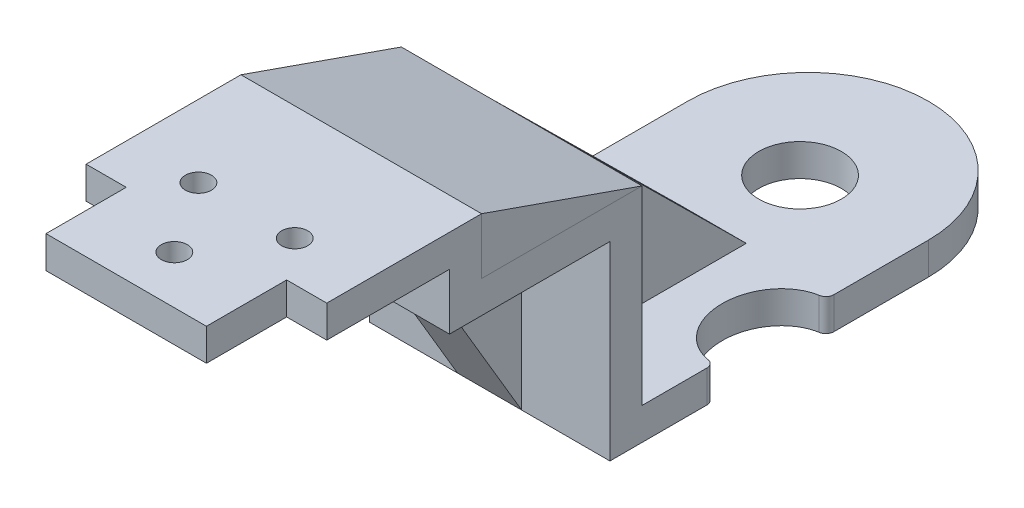
from build123d import *

# Parameters (mm, degrees)
SKETCH_1_R           = 1.625
EXTRUDE_1_DEPTH      = 4
SKETCH_2_W           = 30
SKETCH_2_H           = 11
EXTRUDE_2_DEPTH      = 4
SKETCH_3_W           = 30
SKETCH_3_H           = 24
EXTRUDE_3_DEPTH      = 4
EXTRUDE_4_DEPTH      = 30
SKETCH_5_W           = 4
SKETCH_5_H           = 23.7
EXTRUDE_5_DEPTH      = 30
SKETCH_6_W           = 30.00005
SKETCH_6_H           = 54.7
SKETCH_6_R           = 5.15
EXTRUDE_6_DEPTH      = 4
CUT_EXTRUDE_1_REACH  = 108.907
SKETCH_8_RX          = 7
SKETCH_8_RY          = 6
FILLET_START         = -32
FILLET_2_DEPTH       = 6
FILLET_3_R           = 15
EXTRUDE_8_DEPTH      = 4
EXTRUDE_8_DEPTH_BACK = 4
EXTRUDE_9_DEPTH      = 4
EXTRUDE_9_DEPTH_BACK = 4


with BuildPart() as part:
    # Эскиз1 → Бобышка-Вытянуть1 (new body)
    with BuildSketch(Plane(origin=(0, 0, 0), x_dir=(1, 0, 0), z_dir=(0, 1, 0))):
        Polygon((-10, 0), (10, 0), (10, 10), (15, 10), (15, 25.3), (-15, 25.3), (-15, 10), (-10, 10), align=None)
        with Locations(Location((-6, 15, 0), (0, 0, 270))):
            Circle(SKETCH_1_R, mode=Mode.SUBTRACT)
        with Locations(Location((0, 6, 0), (0, 0, 270))):
            Circle(SKETCH_1_R, mode=Mode.SUBTRACT)
        with Locations(Location((6, 15, 0), (0, 0, 90))):
            Circle(SKETCH_1_R, mode=Mode.SUBTRACT)
    extrude(amount=EXTRUDE_1_DEPTH)

    # Эскиз2 → Бобышка-Вытянуть2 (add)
    with BuildSketch(Plane(origin=(0, 0, -25.3), x_dir=(-1, 0, 0), z_dir=(0, 0, -1))):
        with Locations((0, -1.5)):
            Rectangle(SKETCH_2_W, SKETCH_2_H)
    extrude(amount=EXTRUDE_2_DEPTH)

    # Эскиз3 → Бобышка-Вытянуть3 (add)
    with BuildSketch(Plane.XZ.offset(7)):
        with Locations((0, -37.3)):
            Rectangle(SKETCH_3_W, SKETCH_3_H)
    extrude(amount=-EXTRUDE_3_DEPTH)

    # Эскиз4 → Бобышка-Вытянуть4 (add, through all)
    with BuildSketch(Plane.ZY.offset(15)):
        Polygon((-29.3, 4), (-29.3, -3), (-49.3, -3), align=None)
    extrude(amount=-EXTRUDE_4_DEPTH)

    # Эскиз5 → Бобышка-Вытянуть5 (add, through all)
    with BuildSketch(Plane(origin=(15, 0, 0), x_dir=(0, 0, -1), z_dir=(1, 0, 0))):
        with Locations((47.3, -18.85)):
            Rectangle(SKETCH_5_W, SKETCH_5_H)
    extrude(amount=-EXTRUDE_5_DEPTH)

    # Эскиз6 → Бобышка-Вытянуть6 (add)
    with BuildSketch(Plane.XZ.offset(30.7)):
        with Locations((-2.5e-05, -72.65)):
            Rectangle(SKETCH_6_W, SKETCH_6_H)
        with Locations(Location((-2.5e-05, -84, 0), (0, 0, 270))):
            Circle(SKETCH_6_R, mode=Mode.SUBTRACT)
    extrude(amount=-EXTRUDE_6_DEPTH)

    # Эскиз8 → Вырез-Вытянуть1 (cut, up to next)
    with BuildSketch(Plane.XZ.offset(30.7), mode=Mode.PRIVATE) as cut_extrude_1_sk1:
        with Locations(Location((15, -65.3), (0, 0, -90))):
            Ellipse(SKETCH_8_RX, SKETCH_8_RY)
    cut_extrude_1_tool1 = extrude(cut_extrude_1_sk1.sketch, amount=-CUT_EXTRUDE_1_REACH, mode=Mode.PRIVATE) & part.part
    # Эскиз8 → Вырез-Вытянуть1 (cut, up to next)
    with BuildSketch(Plane.XZ.offset(30.7), mode=Mode.PRIVATE) as cut_extrude_1_sk2:
        with Locations(Location((-15.000018282, -65.299986289), (0, 0, -90.000052373))):
            Ellipse(SKETCH_8_RX, SKETCH_8_RY)
    cut_extrude_1_tool2 = extrude(cut_extrude_1_sk2.sketch, amount=-CUT_EXTRUDE_1_REACH, mode=Mode.PRIVATE) & part.part
    add(cut_extrude_1_tool1.solids().sort_by_distance((15, -30.7, -65.3))[0], mode=Mode.SUBTRACT)
    add(cut_extrude_1_tool2.solids().sort_by_distance((-15.000018, -30.7, -65.299986))[0], mode=Mode.SUBTRACT)

    # Скругление2: read off the stored shape, not the designer's step
    # Скругление2 outline → Скругление2 (cut)
    with BuildSketch(Plane(origin=(0, 0, 0), x_dir=(1, 0, 0), z_dir=(0, 1, 0)).offset(FILLET_START)):
        with BuildLine():
            Line((15, 72.3), (15, 73.218180859))
            ThreePointArc((15, 73.218180859), (14.762336304, 72.570999772), (14.162313281, 72.231441583))
            add(Edge.make_bspline(
                [(14.162313281, 72.231441583), (14.579095458, 72.3), (15, 72.3)],
                knots=[6.131749827, 6.131749827, 6.131749827, 6.283185307, 6.283185307, 6.283185307], degree=2, weights=[0.948970652, 0.971763096, 1]))
        make_face()
        with BuildLine():
            add(Edge.make_bspline(
                [(15, 58.3), (14.579095458, 58.3), (14.162313281, 58.368558417)],
                knots=[3.141592654, 3.141592654, 3.141592654, 3.293028134, 3.293028134, 3.293028134], degree=2, weights=[1, 0.971763096, 0.948970652]))
            ThreePointArc((14.162313281, 58.368558417), (14.762336304, 58.029000228), (15, 57.381819141))
            Line((15, 57.381819141), (15, 58.3))
        make_face()
        with BuildLine():
            add(Edge.make_bspline(
                [(-15.00005, 72.299986289), (-14.579143154, 72.299988746), (-14.162358429, 72.231432015)],
                knots=[6.283181087, 6.283181087, 6.283181087, 6.434617466, 6.434617466, 6.434617466], degree=2, weights=[1, 0.971762843, 0.948970209]))
            ThreePointArc((-14.162358429, 72.231432015), (-14.762384713, 72.570989127), (-15.00005, 73.218172089))
            Line((-15.00005, 73.218172089), (-15.00005, 72.299986289))
        make_face()
        with BuildLine():
            ThreePointArc((-15.00005, 57.381799936), (-14.762384538, 58.028983103), (-14.162357897, 58.368540098))
            add(Edge.make_bspline(
                [(-14.162357897, 58.368540098), (-14.579142884, 58.299983554), (-15.00005, 58.299986289)],
                knots=[9.27334784, 9.27334784, 9.27334784, 9.424784314, 9.424784314, 9.424784314], degree=2, weights=[0.948970181, 0.971762826, 1]))
            Line((-15.00005, 58.299986289), (-15.00005, 57.381799936))
        make_face()
    extrude(amount=FILLET_2_DEPTH, mode=Mode.SUBTRACT)

    # Скругление3
    fillet_3_edges = [part.edges().sort_by_distance(p)[0] for p in [
        (-15.00005, -28.7, -100),
        (15, -28.7, -100),
    ]]
    fillet(fillet_3_edges, radius=FILLET_3_R)

    # Эскиз10 → Бобышка-Вытянуть8 (add, two sides: drawn at the far end of the back side and taken through both)
    with BuildSketch(Plane.ZY.offset(2.5e-05).offset(-EXTRUDE_8_DEPTH_BACK)):
        Polygon((-49.3, -26.7), (-73.3, -26.7), (-49.3, -3), align=None)
    extrude(amount=EXTRUDE_8_DEPTH + EXTRUDE_8_DEPTH_BACK)

    # Эскиз11 → Бобышка-Вытянуть9 (add, two sides: drawn at the far end of the back side and taken through both)
    with BuildSketch(Plane.ZY.offset(2.5e-05).offset(-EXTRUDE_9_DEPTH_BACK)):
        Polygon((-31.3, -7), (-45.3, -7), (-45.3, -30.7), align=None)
    extrude(amount=EXTRUDE_9_DEPTH + EXTRUDE_9_DEPTH_BACK)


solid = part.part
